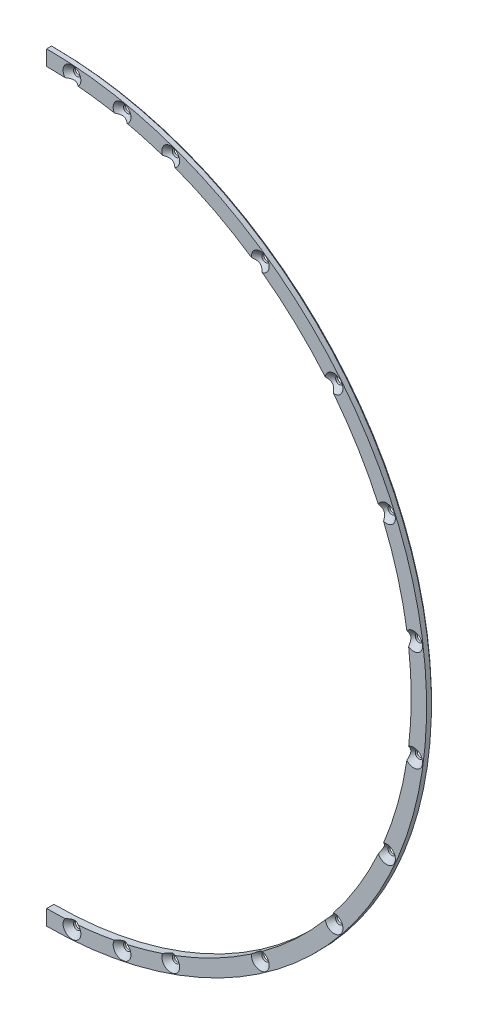
from build123d import *

# Parameters (mm, degrees)
SKETCH1_R           = 1.55
BOSS_EXTRUDE1_DEPTH = 3.048
CHAMFER2_SIZE       = 1


with BuildPart() as part:
    # Sketch1 → Boss-Extrude1 (new body)
    with BuildSketch(Plane.XY):
        with BuildLine():
            Line((0, -160.4), (0, -153.9))
            ThreePointArc((0, -153.9), (153.9, 0), (0, 153.9))
            Line((0, 153.9), (0, 160.4))
            ThreePointArc((0, 160.4), (160.4, 0), (0, -160.4))
        make_face()
        with Locations((10.67311345, -156.035395501)):
            Circle(SKETCH1_R, mode=Mode.SUBTRACT)
        with Locations((31.820520441, -153.128751314)):
            Circle(SKETCH1_R, mode=Mode.SUBTRACT)
        with Locations((52.375171344, -147.369608219)):
            Circle(SKETCH1_R, mode=Mode.SUBTRACT)
        with Locations((90.192802379, -127.774091267)):
            Circle(SKETCH1_R, mode=Mode.SUBTRACT)
        with Locations((121.321245866, -98.702154493)):
            Circle(SKETCH1_R, mode=Mode.SUBTRACT)
        with Locations((143.451847555, -62.309930452)):
            Circle(SKETCH1_R, mode=Mode.SUBTRACT)
        with Locations((154.94328196, -21.296463919)):
            Circle(SKETCH1_R, mode=Mode.SUBTRACT)
        with Locations(Location((10.67311345, 156.035395501, 0), (0, 0, 180))):
            Circle(SKETCH1_R, mode=Mode.SUBTRACT)
        with Locations(Location((154.94328196, 21.296463919, 0), (0, 0, 180))):
            Circle(SKETCH1_R, mode=Mode.SUBTRACT)
        with Locations(Location((143.451847555, 62.309930452, 0), (0, 0, 180))):
            Circle(SKETCH1_R, mode=Mode.SUBTRACT)
        with Locations(Location((121.321245866, 98.702154493, 0), (0, 0, 180))):
            Circle(SKETCH1_R, mode=Mode.SUBTRACT)
        with Locations(Location((90.192802379, 127.774091267, 0), (0, 0, 180))):
            Circle(SKETCH1_R, mode=Mode.SUBTRACT)
        with Locations(Location((52.375171344, 147.369608219, 0), (0, 0, 180))):
            Circle(SKETCH1_R, mode=Mode.SUBTRACT)
        with Locations(Location((31.820520441, 153.128751314, 0), (0, 0, 180))):
            Circle(SKETCH1_R, mode=Mode.SUBTRACT)
    extrude(amount=BOSS_EXTRUDE1_DEPTH)

    # Chamfer1: read off the stored shape, not the designer's step
    # Chamfer1: loft between two sections, ruled curve by curve
    chamfer1_from = [
        Edge.make_three_point_arc((91.742802379, -127.774091267, 0.848), (90.192802379, -126.224091267, 0.848), (88.642802379, -127.774091267, 0.848)),
        Edge.make_three_point_arc((88.642802379, -127.774091267, 0.848), (90.192802379, -129.324091267, 0.848), (91.742802379, -127.774091267, 0.848)),
    ]
    chamfer1_to = [
        Edge.make_three_point_arc((93.942802379, -127.774091267, 3.048), (90.192802379, -124.024091267, 3.048), (86.442802379, -127.774091267, 3.048)),
        Edge.make_three_point_arc((86.442802379, -127.774091267, 3.048), (90.192802379, -131.524091267, 3.048), (93.942802379, -127.774091267, 3.048)),
    ]
    chamfer1 = Solid(Shell([*[Face.make_surface_from_curves(chamfer1_from[k], chamfer1_to[k]) for k in range(2)], Face(Wire(chamfer1_from)), Face(Wire(chamfer1_to))]))
    add(chamfer1, mode=Mode.SUBTRACT)

    # Chamfer1 2: loft between two sections, ruled curve by curve
    chamfer1_2_from = [
        Edge.make_three_point_arc((12.22311345, -156.035395501, 0.848), (10.67311345, -154.485395501, 0.848), (9.12311345, -156.035395501, 0.848)),
        Edge.make_three_point_arc((9.12311345, -156.035395501, 0.848), (10.67311345, -157.585395501, 0.848), (12.22311345, -156.035395501, 0.848)),
    ]
    chamfer1_2_to = [
        Edge.make_three_point_arc((14.42311345, -156.035395501, 3.048), (10.67311345, -152.285395501, 3.048), (6.92311345, -156.035395501, 3.048)),
        Edge.make_three_point_arc((6.92311345, -156.035395501, 3.048), (10.67311345, -159.785395501, 3.048), (14.42311345, -156.035395501, 3.048)),
    ]
    chamfer1_2 = Solid(Shell([*[Face.make_surface_from_curves(chamfer1_2_from[k], chamfer1_2_to[k]) for k in range(2)], Face(Wire(chamfer1_2_from)), Face(Wire(chamfer1_2_to))]))
    add(chamfer1_2, mode=Mode.SUBTRACT)

    # Chamfer1 3: loft between two sections, ruled curve by curve
    chamfer1_3_from = [
        Edge.make_three_point_arc((33.370520441, -153.128751314, 0.848), (31.820520441, -151.578751314, 0.848), (30.270520441, -153.128751314, 0.848)),
        Edge.make_three_point_arc((30.270520441, -153.128751314, 0.848), (31.820520441, -154.678751314, 0.848), (33.370520441, -153.128751314, 0.848)),
    ]
    chamfer1_3_to = [
        Edge.make_three_point_arc((35.570520441, -153.128751314, 3.048), (31.820520441, -149.378751314, 3.048), (28.070520441, -153.128751314, 3.048)),
        Edge.make_three_point_arc((28.070520441, -153.128751314, 3.048), (31.820520441, -156.878751314, 3.048), (35.570520441, -153.128751314, 3.048)),
    ]
    chamfer1_3 = Solid(Shell([*[Face.make_surface_from_curves(chamfer1_3_from[k], chamfer1_3_to[k]) for k in range(2)], Face(Wire(chamfer1_3_from)), Face(Wire(chamfer1_3_to))]))
    add(chamfer1_3, mode=Mode.SUBTRACT)

    # Chamfer1 4: loft between two sections, ruled curve by curve
    chamfer1_4_from = [
        Edge.make_three_point_arc((53.925171344, -147.369608219, 0.848), (52.375171344, -145.819608219, 0.848), (50.825171344, -147.369608219, 0.848)),
        Edge.make_three_point_arc((50.825171344, -147.369608219, 0.848), (52.375171344, -148.919608219, 0.848), (53.925171344, -147.369608219, 0.848)),
    ]
    chamfer1_4_to = [
        Edge.make_three_point_arc((56.125171344, -147.369608219, 3.048), (52.375171344, -143.619608219, 3.048), (48.625171344, -147.369608219, 3.048)),
        Edge.make_three_point_arc((48.625171344, -147.369608219, 3.048), (52.375171344, -151.119608219, 3.048), (56.125171344, -147.369608219, 3.048)),
    ]
    chamfer1_4 = Solid(Shell([*[Face.make_surface_from_curves(chamfer1_4_from[k], chamfer1_4_to[k]) for k in range(2)], Face(Wire(chamfer1_4_from)), Face(Wire(chamfer1_4_to))]))
    add(chamfer1_4, mode=Mode.SUBTRACT)

    # Chamfer1 5: loft between two sections, ruled curve by curve
    chamfer1_5_from = [
        Edge.make_three_point_arc((122.871245866, -98.702154493, 0.848), (121.321245866, -97.152154493, 0.848), (119.771245866, -98.702154493, 0.848)),
        Edge.make_three_point_arc((119.771245866, -98.702154493, 0.848), (121.321245866, -100.252154493, 0.848), (122.871245866, -98.702154493, 0.848)),
    ]
    chamfer1_5_to = [
        Edge.make_three_point_arc((125.071245866, -98.702154493, 3.048), (121.321245866, -94.952154493, 3.048), (117.571245866, -98.702154493, 3.048)),
        Edge.make_three_point_arc((117.571245866, -98.702154493, 3.048), (121.321245866, -102.452154493, 3.048), (125.071245866, -98.702154493, 3.048)),
    ]
    chamfer1_5 = Solid(Shell([*[Face.make_surface_from_curves(chamfer1_5_from[k], chamfer1_5_to[k]) for k in range(2)], Face(Wire(chamfer1_5_from)), Face(Wire(chamfer1_5_to))]))
    add(chamfer1_5, mode=Mode.SUBTRACT)

    # Chamfer1 6: loft between two sections, ruled curve by curve
    chamfer1_6_from = [
        Edge.make_three_point_arc((145.001847555, -62.309930452, 0.848), (143.451847555, -60.759930452, 0.848), (141.901847555, -62.309930452, 0.848)),
        Edge.make_three_point_arc((141.901847555, -62.309930452, 0.848), (143.451847555, -63.859930452, 0.848), (145.001847555, -62.309930452, 0.848)),
    ]
    chamfer1_6_to = [
        Edge.make_three_point_arc((147.201847555, -62.309930452, 3.048), (143.451847555, -58.559930452, 3.048), (139.701847555, -62.309930452, 3.048)),
        Edge.make_three_point_arc((139.701847555, -62.309930452, 3.048), (143.451847555, -66.059930452, 3.048), (147.201847555, -62.309930452, 3.048)),
    ]
    chamfer1_6 = Solid(Shell([*[Face.make_surface_from_curves(chamfer1_6_from[k], chamfer1_6_to[k]) for k in range(2)], Face(Wire(chamfer1_6_from)), Face(Wire(chamfer1_6_to))]))
    add(chamfer1_6, mode=Mode.SUBTRACT)

    # Chamfer1 7: loft between two sections, ruled curve by curve
    chamfer1_7_from = [
        Edge.make_three_point_arc((156.49328196, -21.296463919, 0.848), (154.94328196, -19.746463919, 0.848), (153.39328196, -21.296463919, 0.848)),
        Edge.make_three_point_arc((153.39328196, -21.296463919, 0.848), (154.94328196, -22.846463919, 0.848), (156.49328196, -21.296463919, 0.848)),
    ]
    chamfer1_7_to = [
        Edge.make_three_point_arc((158.69328196, -21.296463919, 3.048), (154.94328196, -17.546463919, 3.048), (151.19328196, -21.296463919, 3.048)),
        Edge.make_three_point_arc((151.19328196, -21.296463919, 3.048), (154.94328196, -25.046463919, 3.048), (158.69328196, -21.296463919, 3.048)),
    ]
    chamfer1_7 = Solid(Shell([*[Face.make_surface_from_curves(chamfer1_7_from[k], chamfer1_7_to[k]) for k in range(2)], Face(Wire(chamfer1_7_from)), Face(Wire(chamfer1_7_to))]))
    add(chamfer1_7, mode=Mode.SUBTRACT)

    # Chamfer1 8: loft between two sections, ruled curve by curve
    chamfer1_8_from = [
        Edge.make_three_point_arc((156.49328196, 21.296463919, 0.848), (154.94328196, 22.846463919, 0.848), (153.39328196, 21.296463919, 0.848)),
        Edge.make_three_point_arc((153.39328196, 21.296463919, 0.848), (154.94328196, 19.746463919, 0.848), (156.49328196, 21.296463919, 0.848)),
    ]
    chamfer1_8_to = [
        Edge.make_three_point_arc((158.69328196, 21.296463919, 3.048), (154.94328196, 25.046463919, 3.048), (151.19328196, 21.296463919, 3.048)),
        Edge.make_three_point_arc((151.19328196, 21.296463919, 3.048), (154.94328196, 17.546463919, 3.048), (158.69328196, 21.296463919, 3.048)),
    ]
    chamfer1_8 = Solid(Shell([*[Face.make_surface_from_curves(chamfer1_8_from[k], chamfer1_8_to[k]) for k in range(2)], Face(Wire(chamfer1_8_from)), Face(Wire(chamfer1_8_to))]))
    add(chamfer1_8, mode=Mode.SUBTRACT)

    # Chamfer1 9: loft between two sections, ruled curve by curve
    chamfer1_9_from = [
        Edge.make_three_point_arc((145.001847555, 62.309930452, 0.848), (143.451847555, 63.859930452, 0.848), (141.901847555, 62.309930452, 0.848)),
        Edge.make_three_point_arc((141.901847555, 62.309930452, 0.848), (143.451847555, 60.759930452, 0.848), (145.001847555, 62.309930452, 0.848)),
    ]
    chamfer1_9_to = [
        Edge.make_three_point_arc((147.201847555, 62.309930452, 3.048), (143.451847555, 66.059930452, 3.048), (139.701847555, 62.309930452, 3.048)),
        Edge.make_three_point_arc((139.701847555, 62.309930452, 3.048), (143.451847555, 58.559930452, 3.048), (147.201847555, 62.309930452, 3.048)),
    ]
    chamfer1_9 = Solid(Shell([*[Face.make_surface_from_curves(chamfer1_9_from[k], chamfer1_9_to[k]) for k in range(2)], Face(Wire(chamfer1_9_from)), Face(Wire(chamfer1_9_to))]))
    add(chamfer1_9, mode=Mode.SUBTRACT)

    # Chamfer1 10: loft between two sections, ruled curve by curve
    chamfer1_10_from = [
        Edge.make_three_point_arc((122.871245866, 98.702154493, 0.848), (121.321245866, 100.252154493, 0.848), (119.771245866, 98.702154493, 0.848)),
        Edge.make_three_point_arc((119.771245866, 98.702154493, 0.848), (121.321245866, 97.152154493, 0.848), (122.871245866, 98.702154493, 0.848)),
    ]
    chamfer1_10_to = [
        Edge.make_three_point_arc((125.071245866, 98.702154493, 3.048), (121.321245866, 102.452154493, 3.048), (117.571245866, 98.702154493, 3.048)),
        Edge.make_three_point_arc((117.571245866, 98.702154493, 3.048), (121.321245866, 94.952154493, 3.048), (125.071245866, 98.702154493, 3.048)),
    ]
    chamfer1_10 = Solid(Shell([*[Face.make_surface_from_curves(chamfer1_10_from[k], chamfer1_10_to[k]) for k in range(2)], Face(Wire(chamfer1_10_from)), Face(Wire(chamfer1_10_to))]))
    add(chamfer1_10, mode=Mode.SUBTRACT)

    # Chamfer1 11: loft between two sections, ruled curve by curve
    chamfer1_11_from = [
        Edge.make_three_point_arc((91.742802379, 127.774091267, 0.848), (90.192802379, 129.324091267, 0.848), (88.642802379, 127.774091267, 0.848)),
        Edge.make_three_point_arc((88.642802379, 127.774091267, 0.848), (90.192802379, 126.224091267, 0.848), (91.742802379, 127.774091267, 0.848)),
    ]
    chamfer1_11_to = [
        Edge.make_three_point_arc((93.942802379, 127.774091267, 3.048), (90.192802379, 131.524091267, 3.048), (86.442802379, 127.774091267, 3.048)),
        Edge.make_three_point_arc((86.442802379, 127.774091267, 3.048), (90.192802379, 124.024091267, 3.048), (93.942802379, 127.774091267, 3.048)),
    ]
    chamfer1_11 = Solid(Shell([*[Face.make_surface_from_curves(chamfer1_11_from[k], chamfer1_11_to[k]) for k in range(2)], Face(Wire(chamfer1_11_from)), Face(Wire(chamfer1_11_to))]))
    add(chamfer1_11, mode=Mode.SUBTRACT)

    # Chamfer1 12: loft between two sections, ruled curve by curve
    chamfer1_12_from = [
        Edge.make_three_point_arc((53.925171344, 147.369608219, 0.848), (52.375171344, 148.919608219, 0.848), (50.825171344, 147.369608219, 0.848)),
        Edge.make_three_point_arc((50.825171344, 147.369608219, 0.848), (52.375171344, 145.819608219, 0.848), (53.925171344, 147.369608219, 0.848)),
    ]
    chamfer1_12_to = [
        Edge.make_three_point_arc((56.125171344, 147.369608219, 3.048), (52.375171344, 151.119608219, 3.048), (48.625171344, 147.369608219, 3.048)),
        Edge.make_three_point_arc((48.625171344, 147.369608219, 3.048), (52.375171344, 143.619608219, 3.048), (56.125171344, 147.369608219, 3.048)),
    ]
    chamfer1_12 = Solid(Shell([*[Face.make_surface_from_curves(chamfer1_12_from[k], chamfer1_12_to[k]) for k in range(2)], Face(Wire(chamfer1_12_from)), Face(Wire(chamfer1_12_to))]))
    add(chamfer1_12, mode=Mode.SUBTRACT)

    # Chamfer1 13: loft between two sections, ruled curve by curve
    chamfer1_13_from = [
        Edge.make_three_point_arc((33.370520441, 153.128751314, 0.848), (31.820520441, 154.678751314, 0.848), (30.270520441, 153.128751314, 0.848)),
        Edge.make_three_point_arc((30.270520441, 153.128751314, 0.848), (31.820520441, 151.578751314, 0.848), (33.370520441, 153.128751314, 0.848)),
    ]
    chamfer1_13_to = [
        Edge.make_three_point_arc((35.570520441, 153.128751314, 3.048), (31.820520441, 156.878751314, 3.048), (28.070520441, 153.128751314, 3.048)),
        Edge.make_three_point_arc((28.070520441, 153.128751314, 3.048), (31.820520441, 149.378751314, 3.048), (35.570520441, 153.128751314, 3.048)),
    ]
    chamfer1_13 = Solid(Shell([*[Face.make_surface_from_curves(chamfer1_13_from[k], chamfer1_13_to[k]) for k in range(2)], Face(Wire(chamfer1_13_from)), Face(Wire(chamfer1_13_to))]))
    add(chamfer1_13, mode=Mode.SUBTRACT)

    # Chamfer1 14: loft between two sections, ruled curve by curve
    chamfer1_14_from = [
        Edge.make_three_point_arc((12.22311345, 156.035395501, 0.848), (10.67311345, 157.585395501, 0.848), (9.12311345, 156.035395501, 0.848)),
        Edge.make_three_point_arc((9.12311345, 156.035395501, 0.848), (10.67311345, 154.485395501, 0.848), (12.22311345, 156.035395501, 0.848)),
    ]
    chamfer1_14_to = [
        Edge.make_three_point_arc((14.42311345, 156.035395501, 3.048), (10.67311345, 159.785395501, 3.048), (6.92311345, 156.035395501, 3.048)),
        Edge.make_three_point_arc((6.92311345, 156.035395501, 3.048), (10.67311345, 152.285395501, 3.048), (14.42311345, 156.035395501, 3.048)),
    ]
    chamfer1_14 = Solid(Shell([*[Face.make_surface_from_curves(chamfer1_14_from[k], chamfer1_14_to[k]) for k in range(2)], Face(Wire(chamfer1_14_from)), Face(Wire(chamfer1_14_to))]))
    add(chamfer1_14, mode=Mode.SUBTRACT)

    # Chamfer2
    chamfer2_edges = [part.edges().sort_by_distance(p)[0] for p in [
        (160.4, 0, 0),
    ]]
    chamfer(chamfer2_edges, length=CHAMFER2_SIZE)


solid = part.part
